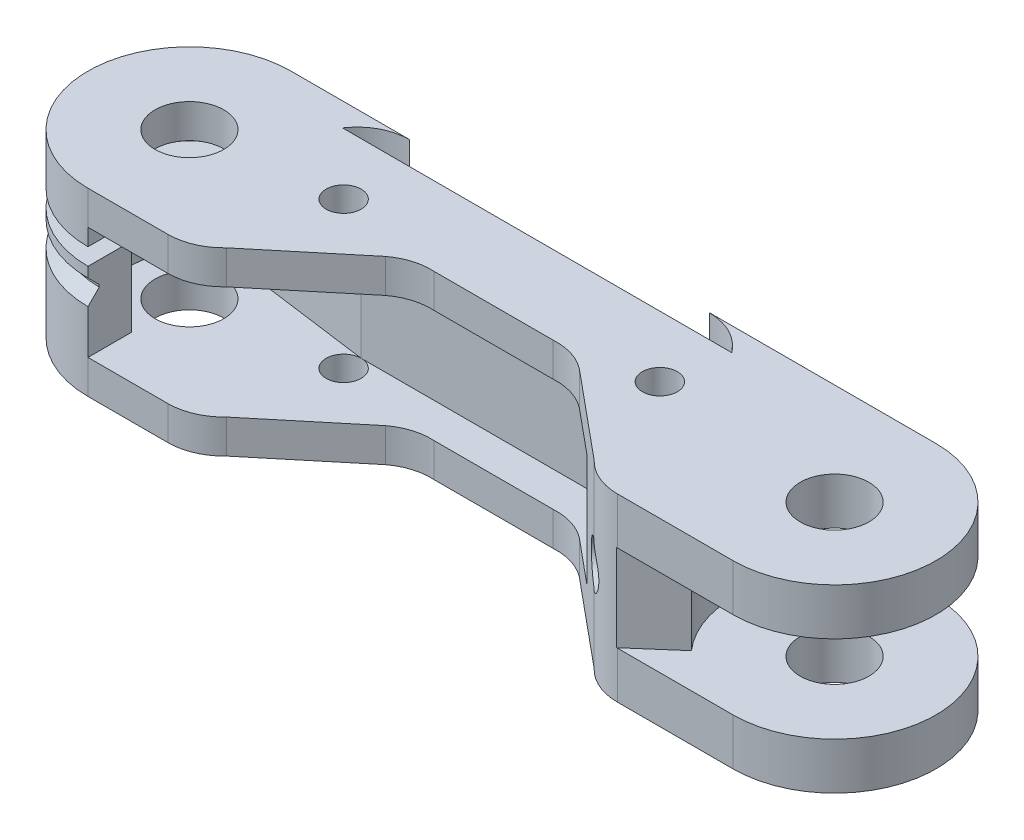
from build123d import *

# Parameters (mm, degrees)
SKETCH_1_R           = 1.55
SKETCH_1_R_2         = 3.05
EXTRUDE_1_DEPTH      = 16
CUT_EXTRUDE_1_DEPTH  = 0.1
CHAMFER_1_SIZE       = 1
CUT_EXTRUDE_2_DEPTH  = 5
CUT_EXTRUDE_3_DEPTH  = 3.85
SKETCH_5_R           = 0.75
CUT_EXTRUDE_4_DEPTH  = 47.006955996
SKETCH_8_R           = 1.85
CUT_EXTRUDE_7_DEPTH  = 4
SKETCH_9_R           = 0.75
CUT_EXTRUDE_8_DEPTH  = 47.00695607
CUT_EXTRUDE_9_DEPTH  = 44.285563471
CUT_EXTRUDE_10_DEPTH = 47.006956155
SKETCH_12_R          = 0.75
CUT_EXTRUDE_11_DEPTH = 57.901377253


with BuildPart() as part:
    # 草图1 → 凸台-拉伸1 (new body)
    with BuildSketch(Plane(origin=(0, 0, 0), x_dir=(1, 0, 0), z_dir=(0, 1, 0))):
        with BuildLine():
            Line((-19.826646667, 9), (19.826646667, 9))
            Line((19.826646667, 9), (30.2, 9))
            ThreePointArc((30.2, 9), (39.2, 0), (30.2, -9))
            Line((30.2, -9), (19.94, -9))
            ThreePointArc((19.94, -9), (17.965722565, -8.593716209), (16.312291898, -7.440891444))
            Line((16.312291898, -7.440891444), (8.605415625, -1.051727342))
            ThreePointArc((8.605415625, -1.051727342), (7.035096162, -0.247891356), (5.283353333, -0.03943856))
            Line((5.283353333, -0.03943856), (-5.283353333, -0.03943856))
            ThreePointArc((-5.283353333, -0.03943856), (-7.035096162, -0.247891356), (-8.605415625, -1.051727342))
            Line((-8.605415625, -1.051727342), (-16.312291898, -7.440891444))
            ThreePointArc((-16.312291898, -7.440891444), (-17.965722565, -8.593716209), (-19.94, -9))
            Line((-19.94, -9), (-27.03, -9))
            ThreePointArc((-27.03, -9), (-36.03, 0), (-27.03, 9))
            Line((-27.03, 9), (-19.826646667, 9))
        make_face()
        with Locations(Location((-14.85, 1.5, 0), (0, 0, 270))):
            Circle(SKETCH_1_R, mode=Mode.SUBTRACT)
        with Locations(Location((13.2, 1.5, 0), (0, 0, 270))):
            Circle(SKETCH_1_R, mode=Mode.SUBTRACT)
        with Locations(Location((-27.03, 0, 0), (0, 0, 270))):
            Circle(SKETCH_1_R_2, mode=Mode.SUBTRACT)
        with Locations(Location((30.2, 0, 0), (0, 0, 270))):
            Circle(SKETCH_1_R_2, mode=Mode.SUBTRACT)
    extrude(amount=EXTRUDE_1_DEPTH)

    # 草图2 → 切除-拉伸1 (cut, symmetric)
    with BuildSketch(Plane(origin=(0, 8, 0), x_dir=(1, 0, 0), z_dir=(0, 1, 0))):
        with BuildLine():
            ThreePointArc((-27.03, 8), (-35.03, 0), (-27.03, -8))
            Line((-27.03, -8), (-27.03, -9))
            ThreePointArc((-27.03, -9), (-36.03, 0), (-27.03, 9))
            Line((-27.03, 9), (-25.390226665, 9))
            Line((-25.390226665, 9), (-24.532130513, 8))
            Line((-24.532130513, 8), (-27.03, 8))
        make_face()
    extrude(amount=CUT_EXTRUDE_1_DEPTH, both=True, mode=Mode.SUBTRACT)

    # 倒角1
    # the kernel refuses this chamfer: 1 mm, written as the material it takes off along each edge
    with BuildSketch(Plane(origin=(-27.03, 8.1, -9), x_dir=(0, 0.9996219169112968, -0.027495876610585647), z_dir=(1, 0, 0))) as chamfer_1_piece_1_section:
        Polygon((CHAMFER_1_SIZE * 0.999621916911, CHAMFER_1_SIZE * 0.0274958766106), (-CHAMFER_1_SIZE * 0.0274958766106, CHAMFER_1_SIZE * 0.999621916911), (0, 0), align=None)
    chamfer_1_piece_1 = extrude(amount=4.211456323, mode=Mode.PRIVATE)
    chamfer_1_piece_1 = split(chamfer_1_piece_1, bisect_by=Plane(origin=(-25.496746935, 8.41540626, -9.124135588), z_dir=(-0.7588990161572768, 0, 0.6512083255575879)), keep=Keep.TOP, mode=Mode.PRIVATE)
    chamfer_1_piece_1 = split(chamfer_1_piece_1, bisect_by=Plane(origin=(-26.057079067, 8.41540626, -8), z_dir=(0, 0, -1)), keep=Keep.TOP, mode=Mode.PRIVATE)
    add(chamfer_1_piece_1, mode=Mode.SUBTRACT)
    with BuildSketch(Plane(origin=(-27.03, 8.1, 0), x_dir=(0, 0, 1), z_dir=(1, 0, 0))) as chamfer_1_piece_2_section:
        Polygon((9, -CHAMFER_1_SIZE), (9 - CHAMFER_1_SIZE, 0), (9, 0), align=None)
    chamfer_1_piece_2 = revolve(axis=Axis((-27.03, 8.1, 0), (0, -1, 0)), revolution_arc=180, mode=Mode.PRIVATE)
    chamfer_1_piece_2 = chamfer_1_piece_2 - Plane(origin=(-27.03, 8.597466919, 0), x_dir=(0, 0, -1), z_dir=(0, 1, 0)) * Cylinder(8, 36, mode=Mode.PRIVATE)
    add(chamfer_1_piece_2, mode=Mode.SUBTRACT)
    with BuildSketch(Plane(origin=(-27.03, 7.9, -9), x_dir=(0, -0.9996219169112968, -0.027495876610585623), z_dir=(1, 0, 0))) as chamfer_1_piece_3_section:
        Polygon((CHAMFER_1_SIZE * 0.999621916911, -CHAMFER_1_SIZE * 0.0274958766106), (-CHAMFER_1_SIZE * 0.0274958766106, -CHAMFER_1_SIZE * 0.999621916911), (0, 0), align=None)
    chamfer_1_piece_3 = extrude(amount=4.211456323, mode=Mode.PRIVATE)
    chamfer_1_piece_3 = split(chamfer_1_piece_3, bisect_by=Plane(origin=(-25.496746935, 7.58459374, -9.124135588), z_dir=(-0.7588990161572768, 0, 0.6512083255575879)), keep=Keep.TOP, mode=Mode.PRIVATE)
    chamfer_1_piece_3 = split(chamfer_1_piece_3, bisect_by=Plane(origin=(-26.057079067, 7.58459374, -8), z_dir=(0, 0, -1)), keep=Keep.TOP, mode=Mode.PRIVATE)
    add(chamfer_1_piece_3, mode=Mode.SUBTRACT)
    with BuildSketch(Plane(origin=(-27.03, 7.9, 0), x_dir=(0, 0, 1), z_dir=(1, 0, 0))) as chamfer_1_piece_4_section:
        Polygon((9, CHAMFER_1_SIZE), (9 - CHAMFER_1_SIZE, 0), (9, 0), align=None)
    chamfer_1_piece_4 = revolve(axis=Axis((-27.03, 7.9, 0), (0, -1, 0)), revolution_arc=180, mode=Mode.PRIVATE)
    chamfer_1_piece_4 = chamfer_1_piece_4 - Plane(origin=(-27.03, 7.402533081, 0), x_dir=(0, 0, -1), z_dir=(0, 1, 0)) * Cylinder(8, 36, mode=Mode.PRIVATE)
    add(chamfer_1_piece_4, mode=Mode.SUBTRACT)

    # 草图3 → 切除-拉伸2 (cut, symmetric)
    with BuildSketch(Plane(origin=(0, 8, 0), x_dir=(1, 0, 0), z_dir=(0, 1, 0))):
        with BuildLine():
            Line((-28.55887307, 4.905447407), (-14.85, 3.05))
            Line((-14.85, 3.05), (13.2, 3.05))
            ThreePointArc((13.2, 3.05), (14.469685669, 2.389043476), (14.656523562, 0.969868778))
            Line((14.656523562, 0.969868778), (11.027788088, -9))
            Line((11.027788088, -9), (-27.03, -9))
            Line((-27.03, -9), (-27.03, -5.138177413))
            ThreePointArc((-27.03, -5.138177413), (-32.109661711, -0.773242543), (-28.55887307, 4.905447407))
        make_face()
    extrude(amount=CUT_EXTRUDE_2_DEPTH, both=True, mode=Mode.SUBTRACT)

    # 草图4 → 切除-拉伸3 (cut, symmetric)
    with BuildSketch(Plane(origin=(0, 8, 0), x_dir=(1, 0, 0), z_dir=(0, 1, 0))):
        with BuildLine():
            Line((30.2, 9), (29.913000447, 9))
            Line((29.913000447, 9), (19.874837727, 9))
            Line((19.874837727, 9), (23.415582139, 5.913685339))
            ThreePointArc((23.415582139, 5.913685339), (21.2, 0), (23.415582139, -5.913685339))
            Line((23.415582139, -5.913685339), (19.874837727, -9))
            Line((19.874837727, -9), (29.913000447, -9))
            Line((29.913000447, -9), (30.2, -9))
            ThreePointArc((30.2, -9), (39.2, 0), (30.2, 9))
        make_face()
    extrude(amount=CUT_EXTRUDE_3_DEPTH, both=True, mode=Mode.SUBTRACT)

    # 草图5 → 切除-拉伸4 (cut, through all)
    with BuildSketch(Plane(origin=(0, 0, -9), x_dir=(-1, 0, 0), z_dir=(0, 0, -1))):
        with Locations((25.390226665, 5.62)):
            Circle(SKETCH_5_R)
    extrude(amount=-CUT_EXTRUDE_4_DEPTH, mode=Mode.SUBTRACT)

    # 草图8 → 切除-拉伸7 (cut, symmetric)
    with BuildSketch(Plane(origin=(2.988481146, 0, -3.604830628), x_dir=(0.7698514076918735, 0, 0.6382231663570673), z_dir=(-0.6382231663570673, 0, 0.7698514076918735))):
        with Locations((17.306990179, 8)):
            Circle(SKETCH_8_R)
    extrude(amount=CUT_EXTRUDE_7_DEPTH, both=True, mode=Mode.SUBTRACT)

    # 草图9 → 切除-拉伸8 (cut, through all)
    with BuildSketch(Plane(origin=(0, 0, -9), x_dir=(-1, 0, 0), z_dir=(0, 0, -1))):
        with Locations((25.390226665, 8)):
            Circle(SKETCH_9_R)
    extrude(amount=-CUT_EXTRUDE_8_DEPTH, mode=Mode.SUBTRACT)

    # 草图11 → 切除-拉伸9 (cut, through all)
    with BuildSketch(Plane(origin=(0, 16, 0), x_dir=(1, 0, 0), z_dir=(0, 1, 0))):
        with BuildLine():
            add(Edge.make_bspline(
                [(-16.493611036, 9), (-18.947322666, 8.943680643), (-20.375839752, 6.921844012)],
                knots=[0.054201279, 0.054201279, 0.054201279, 1, 1, 1], degree=2))
            Line((-20.375839752, 6.921844012), (0, 6.921844012))
            Line((0, 6.921844012), (0, 9))
            Line((0, 9), (-14.925105118, 9))
            Line((-14.925105118, 9), (-16.209012415, 9))
            Line((-16.209012415, 9), (-16.493611036, 9))
        make_face()
        with BuildLine():
            Line((0, 9), (0, 6.921844012))
            Line((0, 6.921844012), (14.15488716, 6.921844012))
            add(Edge.make_bspline(
                [(10.089863114, 9), (12.59455961, 8.924700514), (14.15488716, 6.921844012)],
                knots=[0.072467598, 0.072467598, 0.072467598, 1, 1, 1], degree=2))
            Line((10.089863114, 9), (9.692717359, 9))
            Line((9.692717359, 9), (0, 9))
        make_face()
    extrude(amount=-CUT_EXTRUDE_9_DEPTH, mode=Mode.SUBTRACT)

    # 草图6 → 切除-拉伸10 (cut, through all)
    with BuildSketch(Plane(origin=(0, 0, -9), x_dir=(-1, 0, 0), z_dir=(0, 0, -1))):
        Polygon((33.029885168, 11.49999652), (41.091567373, 11.49999652), (41.091567373, 9.99999652), (33.029885168, 9.99999652), (27.029885168, 9.99999652), (27.029885168, 11.49999652), align=None)
    extrude(amount=-CUT_EXTRUDE_10_DEPTH, mode=Mode.SUBTRACT)

    # 草图12 → 切除-拉伸11 (cut, through all)
    with BuildSketch(Plane(origin=(13.03882177, 0, -14.95866118), x_dir=(-0.7538242067978548, 0, -0.6570761487419743), z_dir=(0.6570761487419743, 0, -0.7538242067978548))):
        with Locations((-11.416969746, 8)):
            Circle(SKETCH_12_R)
    extrude(amount=-CUT_EXTRUDE_11_DEPTH, mode=Mode.SUBTRACT)


solid = part.part
